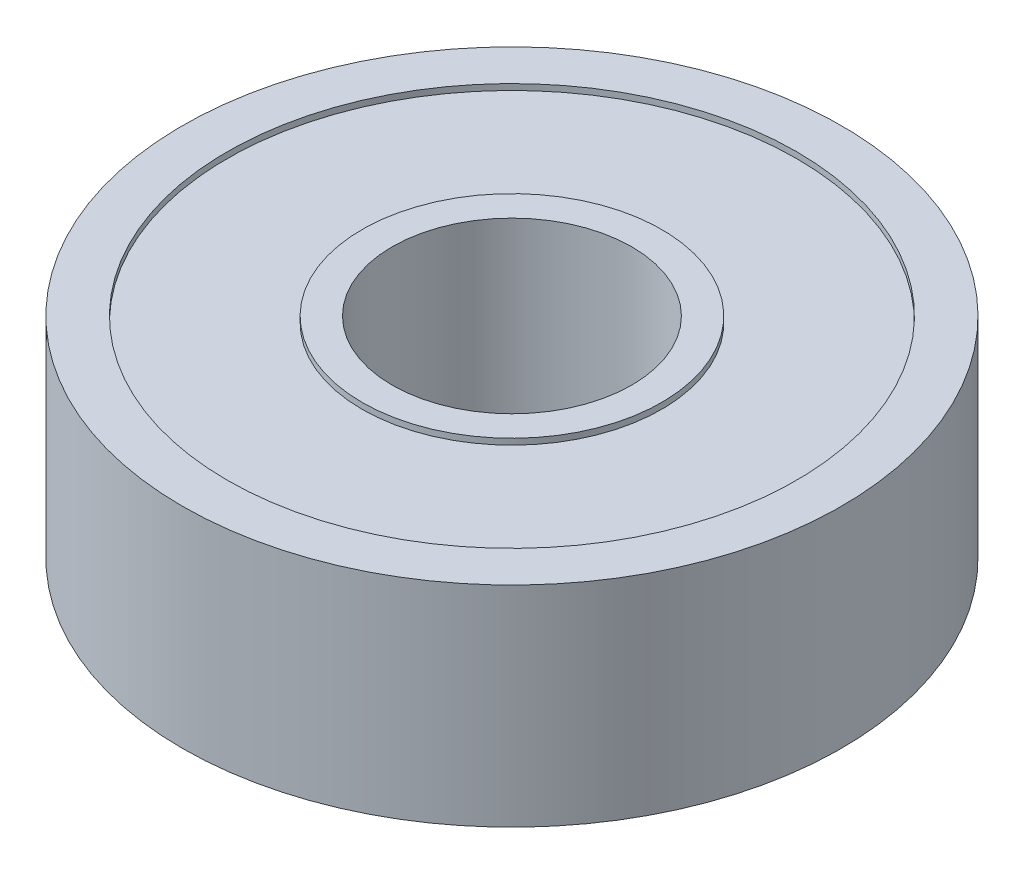
from build123d import *

# Parameters (mm, degrees)
SKETCH1_R             = 11
SKETCH1_R_2           = 4
BOSS_EXTRUDE1_DEPTH   = 3.5
SKETCH2_R             = 9.5
SKETCH2_R_2           = 5
CUT_EXTRUDE1_DEPTH    = 0.1
MIRROR1_START         = -3.5
MIRROR1_OUTLINE_R     = 9.5
MIRROR1_OUTLINE_R_2   = 5
MIRROR1_DEPTH         = 0.1
MIRROR1_START_2       = 3.3
MIRROR1_2_OUTLINE_R   = 9.5
MIRROR1_2_OUTLINE_R_2 = 5
MIRROR1_2_DEPTH       = 0.1


# Read off the part's stored shape, not the designer's step: Mirror1
with BuildPart() as part:
    # Sketch1 → Boss-Extrude1 (new, symmetric)
    with BuildSketch(Plane(origin=(0, 0, 0), x_dir=(1, 0, 0), z_dir=(0, 1, 0))):
        with Locations(Location((0, 0, 0), (0, 0, 270))):
            Circle(SKETCH1_R)
        with Locations(Location((0, 0, 0), (0, 0, 270))):
            Circle(SKETCH1_R_2, mode=Mode.SUBTRACT)
    extrude(amount=BOSS_EXTRUDE1_DEPTH, both=True)

    # Sketch2 → Cut-Extrude1 (cut)
    with BuildSketch(Plane(origin=(0, 3.5, 0), x_dir=(1, 0, 0), z_dir=(0, 1, 0))):
        with Locations(Location((0, 0, 0), (0, 0, 270))):
            Circle(SKETCH2_R)
        with Locations(Location((0, 0, 0), (0, 0, 270))):
            Circle(SKETCH2_R_2, mode=Mode.SUBTRACT)
    extrude(amount=-CUT_EXTRUDE1_DEPTH, mode=Mode.SUBTRACT)

    # Mirror1 outline → Mirror1 (cut)
    with BuildSketch(Plane(origin=(0, 0, 0), x_dir=(1, 0, 0), z_dir=(0, 1, 0)).offset(MIRROR1_START)):
        Circle(MIRROR1_OUTLINE_R)
        Circle(MIRROR1_OUTLINE_R_2, mode=Mode.SUBTRACT)
    extrude(amount=MIRROR1_DEPTH, mode=Mode.SUBTRACT)

    # Mirror1 2 outline → Mirror1 2 (cut)
    with BuildSketch(Plane(origin=(0, 0, 0), x_dir=(1, 0, 0), z_dir=(0, 1, 0)).offset(MIRROR1_START_2)):
        Circle(MIRROR1_2_OUTLINE_R)
        Circle(MIRROR1_2_OUTLINE_R_2, mode=Mode.SUBTRACT)
    extrude(amount=MIRROR1_2_DEPTH, mode=Mode.SUBTRACT)


solid = part.part
